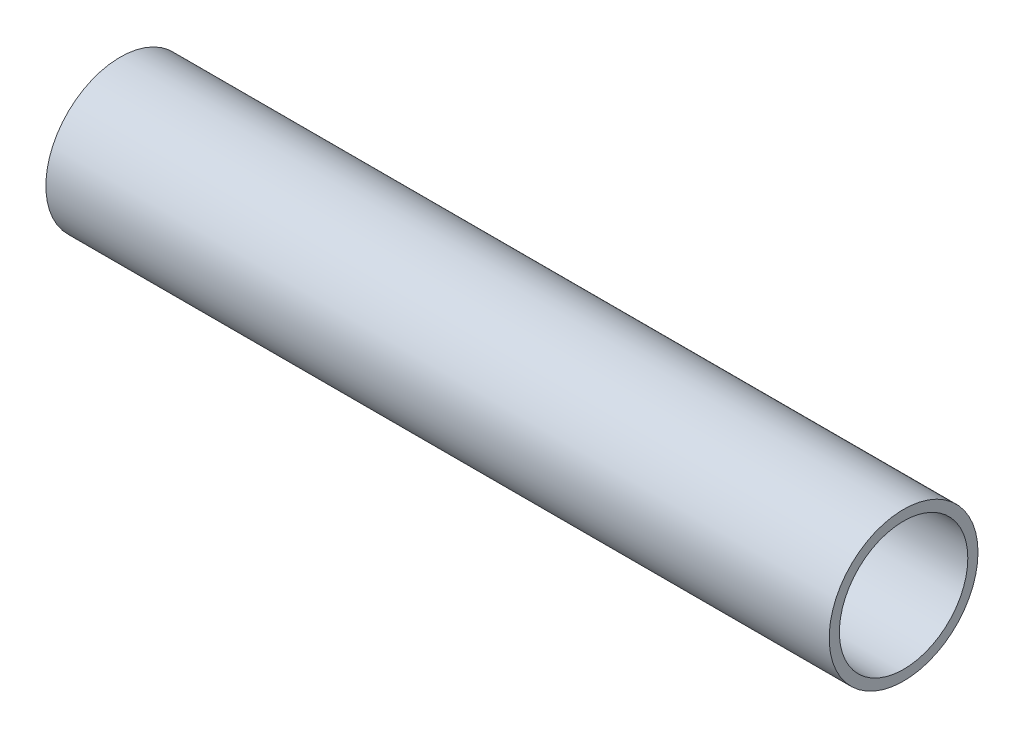
from build123d import *

# Parameters (mm, degrees)
SKETCH1_R           = 9.5
SKETCH1_R_2         = 8.2
BOSS_EXTRUDE1_DEPTH = 100


with BuildPart() as part:
    # Sketch1 → Boss-Extrude1 (new body)
    with BuildSketch(Plane(origin=(0, 0, 0), x_dir=(0, 0, -1), z_dir=(1, 0, 0))):
        Circle(SKETCH1_R)
        Circle(SKETCH1_R_2, mode=Mode.SUBTRACT)
    extrude(amount=BOSS_EXTRUDE1_DEPTH)


solid = part.part
